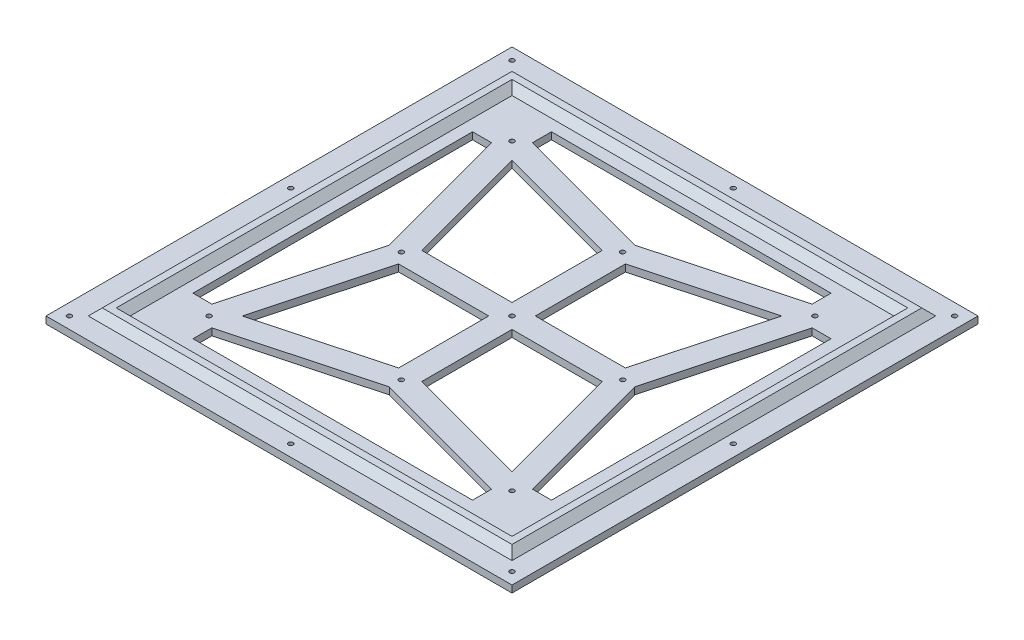
from build123d import *

# Parameters (mm, degrees)
SKETCH1_W           = 200
SKETCH1_H           = 200
BOSS_EXTRUDE1_DEPTH = 3
CUT_EXTRUDE1_REACH  = 143.453
SKETCH2_R           = 1
SKETCH4_W           = 175.857864376
SKETCH4_H           = 175.857864376
SKETCH4_W_2         = 169.857864376
SKETCH4_H_2         = 169.857864376
BOSS_EXTRUDE2_DEPTH = 3
CHAMFER1_SIZE       = 3
CUT_EXTRUDE2_REACH  = 143.453


with BuildPart() as part:
    # Sketch1 → Boss-Extrude1 (new body)
    with BuildSketch(Plane(origin=(0, 0, 0), x_dir=(1, 0, 0), z_dir=(0, 1, 0))):
        Rectangle(SKETCH1_W, SKETCH1_H)
    extrude(amount=BOSS_EXTRUDE1_DEPTH)

    # Sketch2 → Cut-Extrude1 (cut, up to next)
    with BuildSketch(Plane(origin=(0, 3, 0), x_dir=(1, 0, 0), z_dir=(0, 1, 0)), mode=Mode.PRIVATE) as cut_extrude1_sk1:
        with Locations(Location((95, -95, 0), (0, 0, 270))):
            Circle(SKETCH2_R)
    cut_extrude1_tool1 = extrude(cut_extrude1_sk1.sketch, amount=-CUT_EXTRUDE1_REACH, mode=Mode.PRIVATE) & part.part
    # Sketch2 → Cut-Extrude1 (cut, up to next)
    with BuildSketch(Plane(origin=(0, 3, 0), x_dir=(1, 0, 0), z_dir=(0, 1, 0)), mode=Mode.PRIVATE) as cut_extrude1_sk2:
        with Locations(Location((0, -95, 0), (0, 0, 270))):
            Circle(SKETCH2_R)
    cut_extrude1_tool2 = extrude(cut_extrude1_sk2.sketch, amount=-CUT_EXTRUDE1_REACH, mode=Mode.PRIVATE) & part.part
    # Sketch2 → Cut-Extrude1 (cut, up to next)
    with BuildSketch(Plane(origin=(0, 3, 0), x_dir=(1, 0, 0), z_dir=(0, 1, 0)), mode=Mode.PRIVATE) as cut_extrude1_sk3:
        with Locations(Location((-95, -95, 0), (0, 0, 270))):
            Circle(SKETCH2_R)
    cut_extrude1_tool3 = extrude(cut_extrude1_sk3.sketch, amount=-CUT_EXTRUDE1_REACH, mode=Mode.PRIVATE) & part.part
    # Sketch2 → Cut-Extrude1 (cut, up to next)
    with BuildSketch(Plane(origin=(0, 3, 0), x_dir=(1, 0, 0), z_dir=(0, 1, 0)), mode=Mode.PRIVATE) as cut_extrude1_sk4:
        with Locations(Location((-95, 0, 0), (0, 0, 270))):
            Circle(SKETCH2_R)
    cut_extrude1_tool4 = extrude(cut_extrude1_sk4.sketch, amount=-CUT_EXTRUDE1_REACH, mode=Mode.PRIVATE) & part.part
    # Sketch2 → Cut-Extrude1 (cut, up to next)
    with BuildSketch(Plane(origin=(0, 3, 0), x_dir=(1, 0, 0), z_dir=(0, 1, 0)), mode=Mode.PRIVATE) as cut_extrude1_sk5:
        with Locations(Location((-95, 95, 0), (0, 0, 270))):
            Circle(SKETCH2_R)
    cut_extrude1_tool5 = extrude(cut_extrude1_sk5.sketch, amount=-CUT_EXTRUDE1_REACH, mode=Mode.PRIVATE) & part.part
    # Sketch2 → Cut-Extrude1 (cut, up to next)
    with BuildSketch(Plane(origin=(0, 3, 0), x_dir=(1, 0, 0), z_dir=(0, 1, 0)), mode=Mode.PRIVATE) as cut_extrude1_sk6:
        with Locations(Location((0, 0, 0), (0, 0, 270))):
            Circle(SKETCH2_R)
    cut_extrude1_tool6 = extrude(cut_extrude1_sk6.sketch, amount=-CUT_EXTRUDE1_REACH, mode=Mode.PRIVATE) & part.part
    # Sketch2 → Cut-Extrude1 (cut, up to next)
    with BuildSketch(Plane(origin=(0, 3, 0), x_dir=(1, 0, 0), z_dir=(0, 1, 0)), mode=Mode.PRIVATE) as cut_extrude1_sk7:
        with Locations(Location((95, 0, 0), (0, 0, 270))):
            Circle(SKETCH2_R)
    cut_extrude1_tool7 = extrude(cut_extrude1_sk7.sketch, amount=-CUT_EXTRUDE1_REACH, mode=Mode.PRIVATE) & part.part
    # Sketch2 → Cut-Extrude1 (cut, up to next)
    with BuildSketch(Plane(origin=(0, 3, 0), x_dir=(1, 0, 0), z_dir=(0, 1, 0)), mode=Mode.PRIVATE) as cut_extrude1_sk8:
        with Locations(Location((95, 95, 0), (0, 0, 270))):
            Circle(SKETCH2_R)
    cut_extrude1_tool8 = extrude(cut_extrude1_sk8.sketch, amount=-CUT_EXTRUDE1_REACH, mode=Mode.PRIVATE) & part.part
    # Sketch2 → Cut-Extrude1 (cut, up to next)
    with BuildSketch(Plane(origin=(0, 3, 0), x_dir=(1, 0, 0), z_dir=(0, 1, 0)), mode=Mode.PRIVATE) as cut_extrude1_sk9:
        with Locations(Location((0, 95, 0), (0, 0, 270))):
            Circle(SKETCH2_R)
    cut_extrude1_tool9 = extrude(cut_extrude1_sk9.sketch, amount=-CUT_EXTRUDE1_REACH, mode=Mode.PRIVATE) & part.part
    # Sketch2 → Cut-Extrude1 (cut, up to next)
    with BuildSketch(Plane(origin=(0, 3, 0), x_dir=(1, 0, 0), z_dir=(0, 1, 0)), mode=Mode.PRIVATE) as cut_extrude1_sk10:
        with Locations(Location((-47.5, 0, 0), (0, 0, 270))):
            Circle(SKETCH2_R)
    cut_extrude1_tool10 = extrude(cut_extrude1_sk10.sketch, amount=-CUT_EXTRUDE1_REACH, mode=Mode.PRIVATE) & part.part
    # Sketch2 → Cut-Extrude1 (cut, up to next)
    with BuildSketch(Plane(origin=(0, 3, 0), x_dir=(1, 0, 0), z_dir=(0, 1, 0)), mode=Mode.PRIVATE) as cut_extrude1_sk11:
        with Locations(Location((47.5, 0, 0), (0, 0, 270))):
            Circle(SKETCH2_R)
    cut_extrude1_tool11 = extrude(cut_extrude1_sk11.sketch, amount=-CUT_EXTRUDE1_REACH, mode=Mode.PRIVATE) & part.part
    # Sketch2 → Cut-Extrude1 (cut, up to next)
    with BuildSketch(Plane(origin=(0, 3, 0), x_dir=(1, 0, 0), z_dir=(0, 1, 0)), mode=Mode.PRIVATE) as cut_extrude1_sk12:
        with Locations(Location((0, 47.5, 0), (0, 0, 270))):
            Circle(SKETCH2_R)
    cut_extrude1_tool12 = extrude(cut_extrude1_sk12.sketch, amount=-CUT_EXTRUDE1_REACH, mode=Mode.PRIVATE) & part.part
    # Sketch2 → Cut-Extrude1 (cut, up to next)
    with BuildSketch(Plane(origin=(0, 3, 0), x_dir=(1, 0, 0), z_dir=(0, 1, 0)), mode=Mode.PRIVATE) as cut_extrude1_sk13:
        with Locations(Location((0, -47.5, 0), (0, 0, 270))):
            Circle(SKETCH2_R)
    cut_extrude1_tool13 = extrude(cut_extrude1_sk13.sketch, amount=-CUT_EXTRUDE1_REACH, mode=Mode.PRIVATE) & part.part
    # Sketch2 → Cut-Extrude1 (cut, up to next)
    with BuildSketch(Plane(origin=(0, 3, 0), x_dir=(1, 0, 0), z_dir=(0, 1, 0)), mode=Mode.PRIVATE) as cut_extrude1_sk14:
        with Locations(Location((-65, 65, 0), (0, 0, 270))):
            Circle(SKETCH2_R)
    cut_extrude1_tool14 = extrude(cut_extrude1_sk14.sketch, amount=-CUT_EXTRUDE1_REACH, mode=Mode.PRIVATE) & part.part
    # Sketch2 → Cut-Extrude1 (cut, up to next)
    with BuildSketch(Plane(origin=(0, 3, 0), x_dir=(1, 0, 0), z_dir=(0, 1, 0)), mode=Mode.PRIVATE) as cut_extrude1_sk15:
        with Locations(Location((-65, -65, 0), (0, 0, 270))):
            Circle(SKETCH2_R)
    cut_extrude1_tool15 = extrude(cut_extrude1_sk15.sketch, amount=-CUT_EXTRUDE1_REACH, mode=Mode.PRIVATE) & part.part
    # Sketch2 → Cut-Extrude1 (cut, up to next)
    with BuildSketch(Plane(origin=(0, 3, 0), x_dir=(1, 0, 0), z_dir=(0, 1, 0)), mode=Mode.PRIVATE) as cut_extrude1_sk16:
        with Locations(Location((65, -65, 0), (0, 0, 270))):
            Circle(SKETCH2_R)
    cut_extrude1_tool16 = extrude(cut_extrude1_sk16.sketch, amount=-CUT_EXTRUDE1_REACH, mode=Mode.PRIVATE) & part.part
    # Sketch2 → Cut-Extrude1 (cut, up to next)
    with BuildSketch(Plane(origin=(0, 3, 0), x_dir=(1, 0, 0), z_dir=(0, 1, 0)), mode=Mode.PRIVATE) as cut_extrude1_sk17:
        with Locations(Location((65, 65, 0), (0, 0, 270))):
            Circle(SKETCH2_R)
    cut_extrude1_tool17 = extrude(cut_extrude1_sk17.sketch, amount=-CUT_EXTRUDE1_REACH, mode=Mode.PRIVATE) & part.part
    add(cut_extrude1_tool1.solids().sort_by_distance((95, 3, 95))[0], mode=Mode.SUBTRACT)
    add(cut_extrude1_tool2.solids().sort_by_distance((0, 3, 95))[0], mode=Mode.SUBTRACT)
    add(cut_extrude1_tool3.solids().sort_by_distance((-95, 3, 95))[0], mode=Mode.SUBTRACT)
    add(cut_extrude1_tool4.solids().sort_by_distance((-95, 3, 0))[0], mode=Mode.SUBTRACT)
    add(cut_extrude1_tool5.solids().sort_by_distance((-95, 3, -95))[0], mode=Mode.SUBTRACT)
    add(cut_extrude1_tool6.solids().sort_by_distance((0, 3, 0))[0], mode=Mode.SUBTRACT)
    add(cut_extrude1_tool7.solids().sort_by_distance((95, 3, 0))[0], mode=Mode.SUBTRACT)
    add(cut_extrude1_tool8.solids().sort_by_distance((95, 3, -95))[0], mode=Mode.SUBTRACT)
    add(cut_extrude1_tool9.solids().sort_by_distance((0, 3, -95))[0], mode=Mode.SUBTRACT)
    add(cut_extrude1_tool10.solids().sort_by_distance((-47.5, 3, 0))[0], mode=Mode.SUBTRACT)
    add(cut_extrude1_tool11.solids().sort_by_distance((47.5, 3, 0))[0], mode=Mode.SUBTRACT)
    add(cut_extrude1_tool12.solids().sort_by_distance((0, 3, -47.5))[0], mode=Mode.SUBTRACT)
    add(cut_extrude1_tool13.solids().sort_by_distance((0, 3, 47.5))[0], mode=Mode.SUBTRACT)
    add(cut_extrude1_tool14.solids().sort_by_distance((-65, 3, -65))[0], mode=Mode.SUBTRACT)
    add(cut_extrude1_tool15.solids().sort_by_distance((-65, 3, 65))[0], mode=Mode.SUBTRACT)
    add(cut_extrude1_tool16.solids().sort_by_distance((65, 3, 65))[0], mode=Mode.SUBTRACT)
    add(cut_extrude1_tool17.solids().sort_by_distance((65, 3, -65))[0], mode=Mode.SUBTRACT)

    # Sketch4 → Boss-Extrude2 (add)
    with BuildSketch(Plane(origin=(0, 3, 0), x_dir=(1, 0, 0), z_dir=(0, 1, 0))):
        Rectangle(SKETCH4_W, SKETCH4_H)
        Rectangle(SKETCH4_W_2, SKETCH4_H_2, mode=Mode.SUBTRACT)
    extrude(amount=BOSS_EXTRUDE2_DEPTH)

    # Chamfer1
    chamfer1_edges = [part.edges().sort_by_distance(p)[0] for p in [
        (0, 3, -87.928932188),
        (-87.928932188, 3, 0),
        (0, 3, 87.928932188),
        (87.928932188, 3, 0),
        (0, 3, 84.928932188),
        (84.928932188, 3, 0),
        (0, 3, -84.928932188),
        (-84.928932188, 3, 0),
    ]]
    chamfer(chamfer1_edges, length=CHAMFER1_SIZE - 0.0001)  # a hair under: the kernel refuses the full size

    # Sketch5 → Cut-Extrude2 (cut, up to next)
    with BuildSketch(Plane(origin=(0, 3, 0), x_dir=(1, 0, 0), z_dir=(0, 1, 0)), mode=Mode.PRIVATE) as cut_extrude2_sk1:
        Polygon((0, 52.678043084), (-60, 68.831889238), (-60, 76.928932188), (60, 76.928932188), (60, 68.831889238), align=None)
    cut_extrude2_tool1 = extrude(cut_extrude2_sk1.sketch, amount=-CUT_EXTRUDE2_REACH, mode=Mode.PRIVATE) & part.part
    # Sketch5 → Cut-Extrude2 (cut, up to next)
    with BuildSketch(Plane(origin=(0, 3, 0), x_dir=(1, 0, 0), z_dir=(0, 1, 0)), mode=Mode.PRIVATE) as cut_extrude2_sk2:
        Polygon((52.678043084, 0), (68.831889238, 60), (76.928932188, 60), (76.928932188, -60), (68.831889238, -60), align=None)
    cut_extrude2_tool2 = extrude(cut_extrude2_sk2.sketch, amount=-CUT_EXTRUDE2_REACH, mode=Mode.PRIVATE) & part.part
    # Sketch5 → Cut-Extrude2 (cut, up to next)
    with BuildSketch(Plane(origin=(0, 3, 0), x_dir=(1, 0, 0), z_dir=(0, 1, 0)), mode=Mode.PRIVATE) as cut_extrude2_sk3:
        Polygon((0, -52.678043084), (60, -68.831889238), (60, -76.928932188), (-60, -76.928932188), (-60, -68.831889238), align=None)
    cut_extrude2_tool3 = extrude(cut_extrude2_sk3.sketch, amount=-CUT_EXTRUDE2_REACH, mode=Mode.PRIVATE) & part.part
    # Sketch5 → Cut-Extrude2 (cut, up to next)
    with BuildSketch(Plane(origin=(0, 3, 0), x_dir=(1, 0, 0), z_dir=(0, 1, 0)), mode=Mode.PRIVATE) as cut_extrude2_sk4:
        Polygon((-52.678043084, 0), (-68.831889238, -60), (-76.928932188, -60), (-76.928932188, 60), (-68.831889238, 60), align=None)
    cut_extrude2_tool4 = extrude(cut_extrude2_sk4.sketch, amount=-CUT_EXTRUDE2_REACH, mode=Mode.PRIVATE) & part.part
    # Sketch5 → Cut-Extrude2 (cut, up to next)
    with BuildSketch(Plane(origin=(0, 3, 0), x_dir=(1, 0, 0), z_dir=(0, 1, 0)), mode=Mode.PRIVATE) as cut_extrude2_sk5:
        Polygon((-5, 5), (-5, 43.668110762), (-57.914256833, 57.914256833), (-43.668110762, 5), align=None)
    cut_extrude2_tool5 = extrude(cut_extrude2_sk5.sketch, amount=-CUT_EXTRUDE2_REACH, mode=Mode.PRIVATE) & part.part
    # Sketch5 → Cut-Extrude2 (cut, up to next)
    with BuildSketch(Plane(origin=(0, 3, 0), x_dir=(1, 0, 0), z_dir=(0, 1, 0)), mode=Mode.PRIVATE) as cut_extrude2_sk6:
        Polygon((5, 5), (43.668110762, 5), (57.914256833, 57.914256833), (5, 43.668110762), align=None)
    cut_extrude2_tool6 = extrude(cut_extrude2_sk6.sketch, amount=-CUT_EXTRUDE2_REACH, mode=Mode.PRIVATE) & part.part
    # Sketch5 → Cut-Extrude2 (cut, up to next)
    with BuildSketch(Plane(origin=(0, 3, 0), x_dir=(1, 0, 0), z_dir=(0, 1, 0)), mode=Mode.PRIVATE) as cut_extrude2_sk7:
        Polygon((5, -5), (5, -43.668110762), (57.914256833, -57.914256833), (43.668110762, -5), align=None)
    cut_extrude2_tool7 = extrude(cut_extrude2_sk7.sketch, amount=-CUT_EXTRUDE2_REACH, mode=Mode.PRIVATE) & part.part
    # Sketch5 → Cut-Extrude2 (cut, up to next)
    with BuildSketch(Plane(origin=(0, 3, 0), x_dir=(1, 0, 0), z_dir=(0, 1, 0)), mode=Mode.PRIVATE) as cut_extrude2_sk8:
        Polygon((-5, -5), (-43.668110762, -5), (-57.914256833, -57.914256833), (-5, -43.668110762), align=None)
    cut_extrude2_tool8 = extrude(cut_extrude2_sk8.sketch, amount=-CUT_EXTRUDE2_REACH, mode=Mode.PRIVATE) & part.part
    add(cut_extrude2_tool1.solids().sort_by_distance((0, 3, -68.16971))[0], mode=Mode.SUBTRACT)
    add(cut_extrude2_tool2.solids().sort_by_distance((68.16971, 3, 0))[0], mode=Mode.SUBTRACT)
    add(cut_extrude2_tool3.solids().sort_by_distance((0, 3, 68.16971))[0], mode=Mode.SUBTRACT)
    add(cut_extrude2_tool4.solids().sort_by_distance((-68.16971, 3, 0))[0], mode=Mode.SUBTRACT)
    add(cut_extrude2_tool5.solids().sort_by_distance((-29.082771, 3, -29.082771))[0], mode=Mode.SUBTRACT)
    add(cut_extrude2_tool6.solids().sort_by_distance((29.082771, 3, -29.082771))[0], mode=Mode.SUBTRACT)
    add(cut_extrude2_tool7.solids().sort_by_distance((29.082771, 3, 29.082771))[0], mode=Mode.SUBTRACT)
    add(cut_extrude2_tool8.solids().sort_by_distance((-29.082771, 3, 29.082771))[0], mode=Mode.SUBTRACT)


solid = part.part
